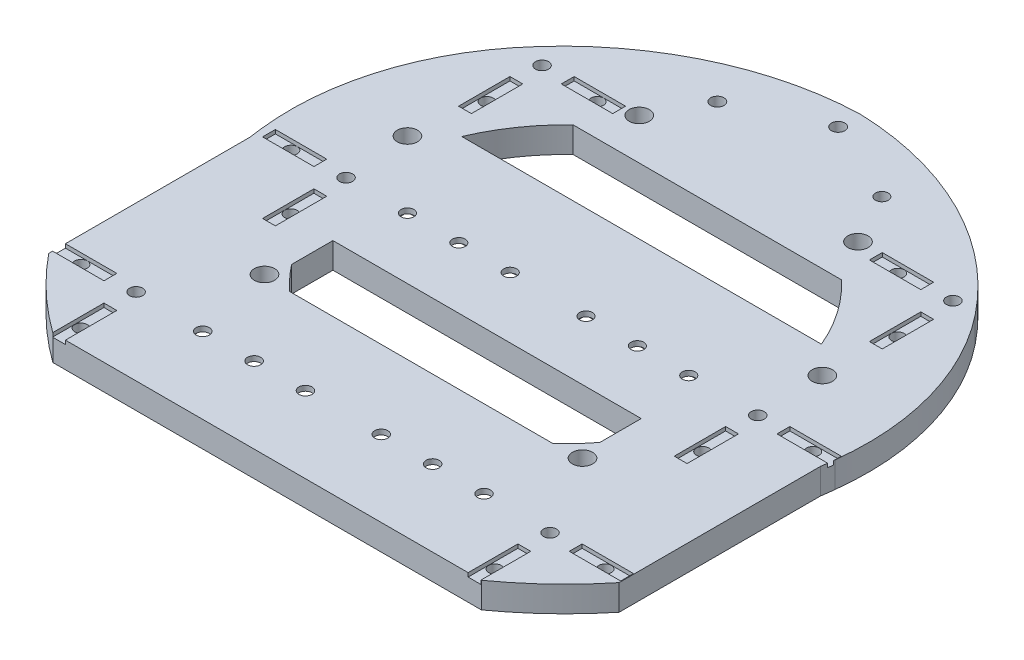
from build123d import *
from build123d.topology import SkipClean

# Parameters (mm, degrees)
SKETCH1_R            = 110
BOSS_EXTRUDE1_DEPTH  = 10
BOSS_EXTRUDE3_START  = -10
BOSS_EXTRUDE3_DEPTH  = 10
BOSS_EXTRUDE4_START  = -10
BOSS_EXTRUDE4_DEPTH  = 10
CUT_EXTRUDE5_START   = -10
CUT_EXTRUDE5_DEPTH   = 10
BOSS_EXTRUDE5_START  = -10
SKETCH13_W           = 9
SKETCH13_H           = 9.000138277
SKETCH13_R           = 2.45
BOSS_EXTRUDE5_DEPTH  = 10
SKETCH15_W           = 9
SKETCH15_H           = 0.2
BOSS_EXTRUDE6_DEPTH  = 10
SKETCH16_W           = 103.03
SKETCH16_H           = 6
CUT_EXTRUDE6_DEPTH   = 10
SKETCH18_W           = 9
SKETCH18_H           = 2
SKETCH18_W_2         = 103.03
BOSS_EXTRUDE7_DEPTH  = 10
CUT_EXTRUDE8_DEPTH   = 3
SKETCH22_W           = 35.363105004
SKETCH22_H           = 35.783804338
SKETCH22_W_2         = 37.314422683
BOSS_EXTRUDE8_DEPTH  = 10
SKETCH23_R           = 2.45
CUT_EXTRUDE9_DEPTH   = 10
SKETCH24_R           = 5
CUT_EXTRUDE10_DEPTH  = 5
SKETCH25_R           = 2.45
CUT_EXTRUDE11_DEPTH  = 10
SKETCH26_R           = 5
CUT_EXTRUDE12_DEPTH  = 5
SKETCH27_W           = 180
SKETCH27_H           = 5
BOSS_EXTRUDE9_DEPTH  = 20
SKETCH28_W           = 60.5
SKETCH28_H           = 20.5
CUT_EXTRUDE13_DEPTH  = 4
SKETCH29_R           = 2.45
CUT_EXTRUDE14_DEPTH  = 6
SKETCH30_W           = 60.5
SKETCH30_H           = 20
CUT_EXTRUDE15_DEPTH  = 3
SKETCH31_W           = 60.5
SKETCH31_H           = 20
CUT_EXTRUDE16_DEPTH  = 3
SKETCH32_R           = 2.45
CUT_EXTRUDE17_DEPTH  = 3
SKETCH33_R           = 2.45
CUT_EXTRUDE18_DEPTH  = 3
CUT_EXTRUDE19_DEPTH  = 13
SKETCH35_W           = 36
SKETCH35_H           = 35
CUT_EXTRUDE20_DEPTH  = 13
BOSS_EXTRUDE10_START = -10
BOSS_EXTRUDE10_DEPTH = 10
SKETCH37_W           = 5
SKETCH37_H           = 20
SKETCH37_W_2         = 20
SKETCH37_H_2         = 5
CUT_EXTRUDE21_DEPTH  = 1.5
SKETCH40_W           = 60.5
SKETCH40_H           = 20.5
CUT_EXTRUDE24_DEPTH  = 4
BOSS_EXTRUDE11_DEPTH = 10
CUT_EXTRUDE25_START  = -10
SKETCH42_R           = 148.189001984
SKETCH42_R_2         = 143
CUT_EXTRUDE25_DEPTH  = 10
SKETCH43_R           = 3.95
CUT_EXTRUDE26_DEPTH  = 10
SKETCH45_W           = 180
SKETCH45_H           = 20
SKETCH45_R           = 2.45
BOSS_EXTRUDE13_DEPTH = 0.5
SKETCH46_W           = 59.75
SKETCH46_H           = 20
CUT_EXTRUDE27_DEPTH  = 0.5
SKETCH47_W           = 60.5
SKETCH47_H           = 20
CUT_EXTRUDE28_DEPTH  = 0.5
SKETCH48_W           = 20
SKETCH48_H           = 5
CUT_EXTRUDE29_DEPTH  = 1.5
SKETCH50_R           = 2.45
CUT_EXTRUDE30_DEPTH  = 11.5
SKETCH49_R           = 2.45
CUT_EXTRUDE31_DEPTH  = 11.5
SKETCH51_R           = 2.45
CUT_EXTRUDE32_DEPTH  = 11.5
SKETCH52_R           = 5
CUT_EXTRUDE33_DEPTH  = 5
CUT_EXTRUDE34_DEPTH  = 3.5
SKETCH54_R           = 6.182205754
SKETCH54_R_2         = 6.908814994
SKETCH54_R_3         = 6.699083007
SKETCH54_R_4         = 7.311072075
BOSS_EXTRUDE14_DEPTH = 10
CUT_EXTRUDE35_START  = -10
CUT_EXTRUDE35_DEPTH  = 10
SKETCH56_R           = 2.45
CUT_EXTRUDE36_DEPTH  = 15
SKETCH57_R           = 2.45
CUT_EXTRUDE37_DEPTH  = 10
CUT_EXTRUDE38_DEPTH  = 4
SKETCH59_W           = 13.303250233
SKETCH59_H           = 41.760637686
SKETCH59_W_2         = 28.804428764
SKETCH59_H_2         = 13.418930669
SKETCH59_W_3         = 38.593692882
SKETCH59_H_3         = 11.205781994
SKETCH59_W_4         = 14.578154864
SKETCH59_H_4         = 26.454585746
SKETCH59_W_5         = 37.510014471
SKETCH59_H_5         = 13.104109406
SKETCH59_H_6         = 26.182090429
SKETCH59_W_6         = 39.272421329
SKETCH59_H_7         = 12.572135059
SKETCH59_W_7         = 13.81426775
SKETCH59_W_8         = 37.780808391
SKETCH59_H_8         = 10.64720748
SKETCH59_W_9         = 11.323538243
SKETCH59_H_9         = 26.005142941
SKETCH59_W_10        = 37.926829509
SKETCH59_H_10        = 11.922879481
SKETCH59_W_11        = 12.073705955
SKETCH59_H_11        = 25.690924596
BOSS_EXTRUDE15_DEPTH = 10
SKETCH62_W           = 60.5
SKETCH62_H           = 20.5
BOSS_EXTRUDE16_DEPTH = 4
SKETCH63_W           = 60.5
SKETCH63_H           = 20.5
SKETCH63_R           = 2.45
CUT_EXTRUDE40_DEPTH  = 4
SKETCH60_R           = 2.55
CUT_EXTRUDE41_DEPTH  = 14
SKETCH65_W           = 5
SKETCH65_H           = 20
SKETCH65_W_2         = 20
SKETCH65_H_2         = 5
CUT_EXTRUDE42_DEPTH  = 1.5
SKETCH66_R           = 2.45
CUT_EXTRUDE43_DEPTH  = 11.5
SKETCH67_W           = 180
SKETCH67_H           = 5
CUT_EXTRUDE44_DEPTH  = 20
BOSS_EXTRUDE17_DEPTH = 20.5
SKETCH70_W           = 180
SKETCH70_H           = 5
CUT_EXTRUDE45_DEPTH  = 20
BOSS_EXTRUDE18_DEPTH = 20.5
SKETCH72_R           = 2.475
CUT_EXTRUDE46_DEPTH  = 2
SKETCH73_R           = 2.475
CUT_EXTRUDE47_DEPTH  = 2
SKETCH74_R           = 6
BOSS_EXTRUDE19_DEPTH = 10
SKETCH75_R           = 2.6
SKETCH75_R_2         = 2.475
CUT_EXTRUDE48_DEPTH  = 10
CUT_EXTRUDE49_DEPTH  = 4
SKETCH77_R           = 5
CUT_EXTRUDE50_DEPTH  = 5
SKETCH79_R           = 2.5
CUT_EXTRUDE51_DEPTH  = 10
SKETCH80_W           = 60.5
SKETCH80_H           = 20.5
CUT_EXTRUDE52_DEPTH  = 4
SKETCH82_R           = 3.95
CUT_EXTRUDE53_DEPTH  = 10
SKETCH83_W           = 181.748773102
SKETCH83_H           = 4.533284398
SKETCH83_W_2         = 180.25
SKETCH83_H_2         = 5
CUT_EXTRUDE54_DEPTH  = 20.5
BOSS_EXTRUDE20_DEPTH = 10
CUT_EXTRUDE55_DEPTH  = 10
BOSS_EXTRUDE21_DEPTH = 10
CUT_EXTRUDE56_DEPTH  = 10
SKETCH89_W           = 35
SKETCH89_H           = 8.5
BOSS_EXTRUDE22_DEPTH = 10
BOSS_EXTRUDE23_DEPTH = 10
SKETCH91_W           = 80.389222886
SKETCH91_H           = 35
CUT_EXTRUDE57_DEPTH  = 10
BOSS_EXTRUDE24_DEPTH = 10
SKETCH95_W           = 140.000488143
SKETCH95_H           = 4.396142649
BOSS_EXTRUDE27_DEPTH = 10
SKETCH86_R           = 3.95
CUT_EXTRUDE58_DEPTH  = 10
SKETCH96_R           = 5
CUT_EXTRUDE59_DEPTH  = 4
SKETCH97_R           = 5
SKETCH97_R_2         = 2.55
CUT_EXTRUDE60_DEPTH  = 0.5
SKETCH98_W           = 0.250583084
SKETCH98_H           = 6.645186685
CUT_EXTRUDE61_DEPTH  = 10
SKETCH100_W          = 60.5
SKETCH100_H          = 20.5
BOSS_EXTRUDE28_DEPTH = 10
SKETCH101_R          = 2.55
CUT_EXTRUDE62_DEPTH  = 10
SKETCH102_W          = 61
SKETCH102_H          = 21
CUT_EXTRUDE63_DEPTH  = 8


with BuildPart() as part:
    # Sketch1 → Boss-Extrude1 (new body)
    with BuildSketch(Plane(origin=(0, 0, 0), x_dir=(1, 0, 0), z_dir=(0, 1, 0))):
        with Locations(Location((0, 0, 0), (0, 0, 270))):
            Circle(SKETCH1_R)
    extrude(amount=BOSS_EXTRUDE1_DEPTH)

    # Sketch10 → Boss-Extrude3 (add)
    with BuildSketch(Plane(origin=(0, 10, 0), x_dir=(1, 0, 0), z_dir=(0, 1, 0)).offset(BOSS_EXTRUDE3_START)):
        with BuildLine():
            Line((-50, 97.979589711), (-50, 125))
            Line((-50, 125), (50, 125))
            Line((50, 125), (50, 97.979589711))
            ThreePointArc((50, 97.979589711), (0, 110), (-50, 97.979589711))
        make_face()
    extrude(amount=BOSS_EXTRUDE3_DEPTH)

    # Sketch11 → Boss-Extrude4 (add)
    with BuildSketch(Plane(origin=(0, 10, 0), x_dir=(1, 0, 0), z_dir=(0, 1, 0)).offset(BOSS_EXTRUDE4_START)):
        with BuildLine():
            ThreePointArc((-56.77, 94.218719478), (-53.41810799, 96.158752793), (-50, 97.979589711))
            Line((-50, 97.979589711), (-50, 125))
            Line((-50, 125), (-56.77, 125))
            Line((-56.77, 125), (-56.77, 94.218719478))
        make_face()
    extrude(amount=BOSS_EXTRUDE4_DEPTH)

    # Sketch12 → Cut-Extrude5 (cut)
    with BuildSketch(Plane(origin=(0, 10, 0), x_dir=(1, 0, 0), z_dir=(0, 1, 0)).offset(CUT_EXTRUDE5_START)):
        with BuildLine():
            Line((50, 125), (46.26, 125))
            Line((46.26, 125), (46.26, 99.799861723))
            ThreePointArc((46.26, 99.799861723), (48.138604545, 98.907404942), (50, 97.979589711))
            Line((50, 97.979589711), (50, 125))
        make_face()
    extrude(amount=CUT_EXTRUDE5_DEPTH, mode=Mode.SUBTRACT)

    # Sketch13 → Boss-Extrude5 (add)
    # profile 1 of 4: a face of its own
    with BuildSketch(Plane(origin=(0, 10, 0), x_dir=(1, 0, 0), z_dir=(0, 1, 0)).offset(BOSS_EXTRUDE5_START)):
        with Locations((-61.27, 104.299930862)):
            Rectangle(SKETCH13_W, SKETCH13_H)
        with Locations(Location((-59.27, 104.299930862, 0), (0, 0, 270))):
            Circle(SKETCH13_R, mode=Mode.SUBTRACT)
    # profile 2 of 4: a face of its own
    with BuildSketch(Plane(origin=(0, 10, 0), x_dir=(1, 0, 0), z_dir=(0, 1, 0)).offset(BOSS_EXTRUDE5_START)):
        with BuildLine():
            Line((-65.77, 99.799861723), (-65.77, 88.17203128))
            ThreePointArc((-65.77, 88.17203128), (-61.344547513, 91.306333244), (-56.77, 94.218719478))
            Line((-56.77, 94.218719478), (-56.77, 99.799861723))
            Line((-56.77, 99.799861723), (-65.77, 99.799861723))
        make_face()
    # profile 3 of 4: a face of its own
    with BuildSketch(Plane(origin=(0, 10, 0), x_dir=(1, 0, 0), z_dir=(0, 1, 0)).offset(BOSS_EXTRUDE5_START)):
        with Locations((50.76, 104.299930862)):
            Rectangle(SKETCH13_W, SKETCH13_H)
        with Locations(Location((48.76, 104.299930862, 0), (0, 0, 270))):
            Circle(SKETCH13_R, mode=Mode.SUBTRACT)
    # profile 4 of 4: a face of its own
    with BuildSketch(Plane(origin=(0, 10, 0), x_dir=(1, 0, 0), z_dir=(0, 1, 0)).offset(BOSS_EXTRUDE5_START)):
        with BuildLine():
            Line((55.26, 95.112209521), (55.26, 99.799861723))
            Line((55.26, 99.799861723), (46.26, 99.799861723))
            ThreePointArc((46.26, 99.799861723), (50.814083882, 97.559873305), (55.26, 95.112209521))
        make_face()
    extrude(amount=BOSS_EXTRUDE5_DEPTH)

    # Sketch15 → Boss-Extrude6 (add)
    with BuildSketch(Plane(origin=(0, 10, 0), x_dir=(1, 0, 0), z_dir=(0, 1, 0))):
        with Locations((50.76, 108.9)):
            Rectangle(SKETCH15_W, SKETCH15_H)
        with Locations((-61.27, 108.9)):
            Rectangle(SKETCH15_W, SKETCH15_H)
    extrude(amount=-BOSS_EXTRUDE6_DEPTH)

    # Sketch16 → Cut-Extrude6 (cut)
    with BuildSketch(Plane(origin=(0, 10, 0), x_dir=(1, 0, 0), z_dir=(0, 1, 0))):
        with Locations((-5.255, 122)):
            Rectangle(SKETCH16_W, SKETCH16_H)
    extrude(amount=-CUT_EXTRUDE6_DEPTH, mode=Mode.SUBTRACT)

    # Sketch18 → Boss-Extrude7 (add)
    with BuildSketch(Plane(origin=(0, 10, 0), x_dir=(1, 0, 0), z_dir=(0, 1, 0))):
        with Locations((-61.27, 110)):
            Rectangle(SKETCH18_W, SKETCH18_H)
        with Locations((-5.255, 120)):
            Rectangle(SKETCH18_W_2, SKETCH18_H)
        with Locations((50.76, 110)):
            Rectangle(SKETCH18_W, SKETCH18_H)
    extrude(amount=-BOSS_EXTRUDE7_DEPTH)

    # Sketch19 → Cut-Extrude8 (cut)
    with BuildSketch(Plane.XZ):
        Polygon((-54.362522712, -104.299930862), (-56.816261356, -100.049930862), (-61.723738644, -100.049930862), (-64.177477288, -104.299930862), (-61.723738644, -108.549930862), (-56.816261356, -108.549930862), align=None)
        Polygon((53.667477288, -104.299930862), (51.213738644, -100.049930862), (46.306261356, -100.049930862), (43.852522712, -104.299930862), (46.306261356, -108.549930862), (51.213738644, -108.549930862), align=None)
        Polygon((-7.847522712, -114), (-10.301261356, -109.75), (-15.208738644, -109.75), (-17.662477288, -114), (-15.208738644, -118.25), (-10.301261356, -118.25), align=None)
        Polygon((7.152477288, -114), (4.698738644, -109.75), (-0.208738644, -109.75), (-2.662477288, -114), (-0.208738644, -118.25), (4.698738644, -118.25), align=None)
    extrude(amount=-CUT_EXTRUDE8_DEPTH, mode=Mode.SUBTRACT)

    # Sketch22 → Boss-Extrude8 (add)
    with BuildSketch(Plane(origin=(0, 10, 0), x_dir=(1, 0, 0), z_dir=(0, 1, 0))):
        with Locations((-72.318447498, -75.408097831)):
            Rectangle(SKETCH22_W, SKETCH22_H)
        with Locations((71.342788658, -75.408097831)):
            Rectangle(SKETCH22_W_2, SKETCH22_H)
    extrude(amount=-BOSS_EXTRUDE8_DEPTH)

    # Sketch23 → Cut-Extrude9 (cut)
    with BuildSketch(Plane.XZ):
        with Locations(Location((-80, 83.8, 0), (0, 0, 270))):
            Circle(SKETCH23_R)
        with Locations(Location((80, 83.8, 0), (0, 0, 270))):
            Circle(SKETCH23_R)
    extrude(amount=-CUT_EXTRUDE9_DEPTH, mode=Mode.SUBTRACT)

    # Sketch24 → Cut-Extrude10 (cut)
    with BuildSketch(Plane.XZ):
        with Locations(Location((-80, 83.8, 0), (0, 0, 270))):
            Circle(SKETCH24_R)
        with Locations(Location((80, 83.8, 0), (0, 0, 270))):
            Circle(SKETCH24_R)
    extrude(amount=-CUT_EXTRUDE10_DEPTH, mode=Mode.SUBTRACT)

    # Sketch25 → Cut-Extrude11 (cut)
    with BuildSketch(Plane.XZ):
        with Locations(Location((-80, 6.8, 0), (0, 0, 270))):
            Circle(SKETCH25_R)
        with Locations(Location((80, 6.8, 0), (0, 0, 90))):
            Circle(SKETCH25_R)
    extrude(amount=-CUT_EXTRUDE11_DEPTH, mode=Mode.SUBTRACT)

    # Sketch26 → Cut-Extrude12 (cut)
    with BuildSketch(Plane.XZ):
        with Locations(Location((-80, 6.8, 0), (0, 0, 270))):
            Circle(SKETCH26_R)
        with Locations(Location((80, 6.8, 0), (0, 0, 270))):
            Circle(SKETCH26_R)
    extrude(amount=-CUT_EXTRUDE12_DEPTH, mode=Mode.SUBTRACT)

    # Sketch27 → Boss-Extrude9 (add)
    with BuildSketch(Plane(origin=(0, 10, 0), x_dir=(1, 0, 0), z_dir=(0, 1, 0))):
        with Locations((0, -70.7)):
            Rectangle(SKETCH27_W, SKETCH27_H)
        with Locations((0, 5.8)):
            Rectangle(SKETCH27_W, SKETCH27_H)
    extrude(amount=BOSS_EXTRUDE9_DEPTH)

    # Sketch28 → Cut-Extrude13 (cut)
    with BuildSketch(Plane.XZ):
        with BuildLine():
            ThreePointArc((58.267572457, 93.3), (57.659545557, 93.676981197), (57.049079747, 94.05))
            Line((57.049079747, 94.05), (4.5, 94.05))
            Line((4.5, 94.05), (4.5, 73.55))
            Line((4.5, 73.55), (65, 73.55))
            Line((65, 73.55), (65, 93.3))
            Line((65, 93.3), (58.267572457, 93.3))
        make_face()
        with Locations((-34.75, 6.8)):
            Rectangle(SKETCH28_W, SKETCH28_H)
        with Locations((34.75, 6.8)):
            Rectangle(SKETCH28_W, SKETCH28_H)
        with Locations((-34.75, 83.8)):
            Rectangle(SKETCH28_W, SKETCH28_H)
    extrude(amount=-CUT_EXTRUDE13_DEPTH, mode=Mode.SUBTRACT)

    # Sketch29 → Cut-Extrude14 (cut)
    with BuildSketch(Plane.XZ.offset(-4)):
        with Locations(Location((-54.75, 86.3, 0), (0, 0, 270))):
            Circle(SKETCH29_R)
        with Locations(Location((-34.75, 86.3, 0), (0, 0, 270))):
            Circle(SKETCH29_R)
        with Locations(Location((-14.75, 86.3, 0), (0, 0, 270))):
            Circle(SKETCH29_R)
        with Locations(Location((14.75, 86.3, 0), (0, 0, 90))):
            Circle(SKETCH29_R)
        with Locations(Location((34.75, 86.3, 0), (0, 0, 90))):
            Circle(SKETCH29_R)
        with Locations(Location((54.75, 86.3, 0), (0, 0, 90))):
            Circle(SKETCH29_R)
        with Locations(Location((54.75, 6.8, 0), (0, 0, 270))):
            Circle(SKETCH29_R)
        with Locations(Location((34.75, 6.8, 0), (0, 0, 270))):
            Circle(SKETCH29_R)
        with Locations(Location((14.75, 6.8, 0), (0, 0, 270))):
            Circle(SKETCH29_R)
        with Locations(Location((-14.75, 6.8, 0), (0, 0, 90))):
            Circle(SKETCH29_R)
        with Locations(Location((-34.75, 6.8, 0), (0, 0, 90))):
            Circle(SKETCH29_R)
        with Locations(Location((-54.75, 6.8, 0), (0, 0, 90))):
            Circle(SKETCH29_R)
    extrude(amount=-CUT_EXTRUDE14_DEPTH, mode=Mode.SUBTRACT)

    # Sketch30 → Cut-Extrude15 (cut)
    with BuildSketch(Plane(origin=(0, 0, 68.2), x_dir=(-1, 0, 0), z_dir=(0, 0, -1))):
        with Locations((0, 20)):
            Rectangle(SKETCH30_W, SKETCH30_H)
    extrude(amount=-CUT_EXTRUDE15_DEPTH, mode=Mode.SUBTRACT)

    # Sketch31 → Cut-Extrude16 (cut)
    with BuildSketch(Plane(origin=(0, 0, -8.3), x_dir=(-1, 0, 0), z_dir=(0, 0, -1))):
        with Locations((0, 20)):
            Rectangle(SKETCH31_W, SKETCH31_H)
    extrude(amount=-CUT_EXTRUDE16_DEPTH, mode=Mode.SUBTRACT)

    # Sketch32 → Cut-Extrude17 (cut)
    with BuildSketch(Plane(origin=(0, 0, 71.2), x_dir=(-1, 0, 0), z_dir=(0, 0, -1))):
        with Locations((-20, 20)):
            Circle(SKETCH32_R)
        with Locations((0, 20)):
            Circle(SKETCH32_R)
        with Locations((20, 20)):
            Circle(SKETCH32_R)
    extrude(amount=-CUT_EXTRUDE17_DEPTH, mode=Mode.SUBTRACT)

    # Sketch33 → Cut-Extrude18 (cut)
    with BuildSketch(Plane(origin=(0, 0, -5.3), x_dir=(-1, 0, 0), z_dir=(0, 0, -1))):
        with Locations((20, 20)):
            Circle(SKETCH33_R)
        with Locations((0, 20)):
            Circle(SKETCH33_R)
        with Locations((-20, 20)):
            Circle(SKETCH33_R)
    extrude(amount=-CUT_EXTRUDE18_DEPTH, mode=Mode.SUBTRACT)

    # Sketch34 → Cut-Extrude19 (cut)
    with BuildSketch(Plane(origin=(0, 10, 0), x_dir=(1, 0, 0), z_dir=(0, 1, 0))):
        Polygon((-25, -22.05), (-60, -22.05), (-60, -52.05), (-60, -60.55), (-25, -60.55), align=None)
    extrude(amount=-CUT_EXTRUDE19_DEPTH, mode=Mode.SUBTRACT)

    # Sketch35 → Cut-Extrude20 (cut)
    with BuildSketch(Plane(origin=(0, 10, 0), x_dir=(1, 0, 0), z_dir=(0, 1, 0))):
        with Locations((-52, 42.7)):
            Rectangle(SKETCH35_W, SKETCH35_H)
    extrude(amount=-CUT_EXTRUDE20_DEPTH, mode=Mode.SUBTRACT)

    # Sketch36 → Boss-Extrude10 (add)
    with BuildSketch(Plane(origin=(0, 10, 0), x_dir=(1, 0, 0), z_dir=(0, 1, 0)).offset(BOSS_EXTRUDE10_START)):
        with BuildLine():
            Line((-110, -93.3), (-90, -93.3))
            Line((-90, -93.3), (-90, -73.2))
            Line((-90, -73.2), (-90, -63.245553203))
            ThreePointArc((-90, -63.245553203), (-104.880884817, -33.166247904), (-110, 0))
            Line((-110, 0), (-110, -93.3))
        make_face()
        with BuildLine():
            Line((-90, -113.3), (90, -113.3))
            Line((90, -113.3), (90, -93.3))
            Line((90, -93.3), (58.267572457, -93.3))
            ThreePointArc((58.267572457, -93.3), (0, -110), (-58.267572457, -93.3))
            Line((-58.267572457, -93.3), (-90, -93.3))
            Line((-90, -93.3), (-90, -113.3))
        make_face()
        with BuildLine():
            Line((90, -73.2), (90, -93.3))
            Line((90, -93.3), (110, -93.3))
            Line((110, -93.3), (110, 0))
            ThreePointArc((110, 0), (104.880884817, -33.166247904), (90, -63.245553203))
            Line((90, -63.245553203), (90, -73.2))
        make_face()
    extrude(amount=BOSS_EXTRUDE10_DEPTH)

    # Sketch37 → Cut-Extrude21 (cut)
    with BuildSketch(Plane(origin=(0, 10, 0), x_dir=(1, 0, 0), z_dir=(0, 1, 0))):
        with Locations((80.75, -26.8)):
            Rectangle(SKETCH37_W, SKETCH37_H)
        with Locations((100.75, -6.8)):
            Rectangle(SKETCH37_W_2, SKETCH37_H_2)
        with Locations((101.5, -83.8)):
            Rectangle(SKETCH37_W_2, SKETCH37_H_2)
        with Locations((81.25, 50.2)):
            Rectangle(SKETCH37_W, SKETCH37_H)
        with Locations((-81.75, 50.2)):
            Rectangle(SKETCH37_W, SKETCH37_H)
        with Locations((-101, -6.8)):
            Rectangle(SKETCH37_W_2, SKETCH37_H_2)
        with Locations((-81, -26.8)):
            Rectangle(SKETCH37_W, SKETCH37_H)
        with Locations((-101.5, -83.8)):
            Rectangle(SKETCH37_W_2, SKETCH37_H_2)
        with Locations((-81.5, -103.8)):
            Rectangle(SKETCH37_W, SKETCH37_H)
        with Locations((81.5, -103.8)):
            Rectangle(SKETCH37_W, SKETCH37_H)
        with Locations((101.25, 70.2)):
            Rectangle(SKETCH37_W_2, SKETCH37_H_2)
    extrude(amount=-CUT_EXTRUDE21_DEPTH, mode=Mode.SUBTRACT)

    # Sketch40 → Cut-Extrude24 (cut)
    with BuildSketch(Plane.XZ):
        with Locations((-34.75, 83.8)):
            Rectangle(SKETCH40_W, SKETCH40_H)
        with Locations((34.75, 83.8)):
            Rectangle(SKETCH40_W, SKETCH40_H)
    extrude(amount=-CUT_EXTRUDE24_DEPTH, mode=Mode.SUBTRACT)

    # Sketch41 → Boss-Extrude11 (add)
    with BuildSketch(Plane.XZ):
        with BuildLine():
            Line((-110, 0), (-110, 91.372862492))
            ThreePointArc((-110, 91.372862492), (-48.574684765, -134.497211867), (143, 0))
            ThreePointArc((143, 0), (134.497211867, 48.574684765), (110, 91.372862492))
            Line((110, 91.372862492), (110, 0))
            ThreePointArc((110, 0), (95.337820407, -54.869845999), (55.26, -95.112209521))
            Line((55.26, -95.112209521), (55.26, -111))
            Line((55.26, -111), (46.26, -111))
            Line((46.26, -111), (46.26, -121))
            Line((46.26, -121), (-56.77, -121))
            Line((-56.77, -121), (-56.77, -111))
            Line((-56.77, -111), (-65.77, -111))
            Line((-65.77, -111), (-65.77, -88.17203128))
            ThreePointArc((-65.77, -88.17203128), (-98.322683039, -49.321901829), (-110, 0))
        make_face()
        with BuildLine():
            Line((-108.370244994, 93.3), (-90, 93.3))
            Line((-90, 93.3), (-90, 111.126054551))
            ThreePointArc((-90, 111.126054551), (-99.584790907, 102.624896687), (-108.370244994, 93.3))
        make_face()
        with BuildLine():
            ThreePointArc((87.247406838, 113.3), (0, 143), (-87.247406838, 113.3))
            Line((-87.247406838, 113.3), (87.247406838, 113.3))
        make_face()
        with BuildLine():
            ThreePointArc((108.370244994, 93.3), (99.584790907, 102.624896687), (90, 111.126054551))
            Line((90, 111.126054551), (90, 93.3))
            Line((90, 93.3), (108.370244994, 93.3))
        make_face()
    extrude(amount=-BOSS_EXTRUDE11_DEPTH)

    # Sketch42 → Cut-Extrude25 (cut)
    with SkipClean():  # the faces are left unmerged after this step: merging them gives an invalid solid
        with BuildSketch(Plane(origin=(0, 10, 0), x_dir=(1, 0, 0), z_dir=(0, 1, 0)).offset(CUT_EXTRUDE25_START)):
            Circle(SKETCH42_R)
            with Locations(Location((0, 0, 0), (0, 0, 90))):
                Circle(SKETCH42_R_2, mode=Mode.SUBTRACT)
        extrude(amount=CUT_EXTRUDE25_DEPTH, mode=Mode.SUBTRACT)
    add(part.part.scale(1), mode=Mode.REPLACE)  # the faces are merged on a copy

    # Sketch43 → Cut-Extrude26 (cut)
    with BuildSketch(Plane(origin=(0, 10, 0), x_dir=(1, 0, 0), z_dir=(0, 1, 0))):
        with Locations(Location((0, 133.5, 0), (0, 0, 270))):
            Circle(SKETCH43_R)
        with Locations(Location((115.614391405, 66.75, 0), (0, 0, 270))):
            Circle(SKETCH43_R)
        with Locations(Location((115.614391405, -66.75, 0), (0, 0, 270))):
            Circle(SKETCH43_R)
        with Locations(Location((0, -133.5, 0), (0, 0, 270))):
            Circle(SKETCH43_R)
        with Locations(Location((-115.614391405, -66.75, 0), (0, 0, 270))):
            Circle(SKETCH43_R)
        with Locations(Location((-115.614391405, 66.75, 0), (0, 0, 270))):
            Circle(SKETCH43_R)
    extrude(amount=-CUT_EXTRUDE26_DEPTH, mode=Mode.SUBTRACT)

    # Sketch45 → Boss-Extrude13 (add)
    with BuildSketch(Plane.XY.offset(73.2)):
        with Locations((0, 20)):
            Rectangle(SKETCH45_W, SKETCH45_H)
        with Locations(Location((-20, 20, 0), (0, 0, 180))):
            Circle(SKETCH45_R, mode=Mode.SUBTRACT)
        with Locations(Location((0, 20, 0), (0, 0, 180))):
            Circle(SKETCH45_R, mode=Mode.SUBTRACT)
        with Locations(Location((20, 20, 0), (0, 0, 180))):
            Circle(SKETCH45_R, mode=Mode.SUBTRACT)
    extrude(amount=BOSS_EXTRUDE13_DEPTH)

    # Sketch46 → Cut-Extrude27 (cut)
    with BuildSketch(Plane(origin=(0, 0, 68.2), x_dir=(-1, 0, 0), z_dir=(0, 0, -1))):
        with Locations((-60.125, 20)):
            Rectangle(SKETCH46_W, SKETCH46_H)
        with Locations((60.125, 20)):
            Rectangle(SKETCH46_W, SKETCH46_H)
    extrude(amount=-CUT_EXTRUDE27_DEPTH, mode=Mode.SUBTRACT)

    # Sketch47 → Cut-Extrude28 (cut)
    with BuildSketch(Plane(origin=(0, 0, 71.2), x_dir=(-1, 0, 0), z_dir=(0, 0, -1))):
        with Locations((0, 20)):
            Rectangle(SKETCH47_W, SKETCH47_H)
    extrude(amount=-CUT_EXTRUDE28_DEPTH, mode=Mode.SUBTRACT)

    # Sketch48 → Cut-Extrude29 (cut)
    with BuildSketch(Plane(origin=(0, 10, 0), x_dir=(1, 0, 0), z_dir=(0, 1, 0))):
        with Locations((-61.75, 70.2)):
            Rectangle(SKETCH48_W, SKETCH48_H)
        with Locations((61.25, 70.2)):
            Rectangle(SKETCH48_W, SKETCH48_H)
    extrude(amount=-CUT_EXTRUDE29_DEPTH, mode=Mode.SUBTRACT)

    # Sketch50 → Cut-Extrude30 (cut)
    with BuildSketch(Plane(origin=(0, 8.5, 0), x_dir=(1, 0, 0), z_dir=(0, 1, 0))):
        with Locations(Location((-80, -28.25, 0), (0, 0, 270))):
            Circle(SKETCH50_R)
        with Locations(Location((80, -28.25, 0), (0, 0, 270))):
            Circle(SKETCH50_R)
        with Locations(Location((102.2, -6.8, 0), (0, 0, 270))):
            Circle(SKETCH50_R)
        with Locations(Location((102.95, -83.8, 0), (0, 0, 270))):
            Circle(SKETCH50_R)
        with Locations(Location((80, -105.25, 0), (0, 0, 270))):
            Circle(SKETCH50_R)
        with Locations(Location((-80, -105.25, 0), (0, 0, 270))):
            Circle(SKETCH50_R)
        with Locations(Location((-102.95, -83.8, 0), (0, 0, 270))):
            Circle(SKETCH50_R)
        with Locations(Location((80, 48.75, 0), (0, 0, 270))):
            Circle(SKETCH50_R)
        with Locations(Location((59.8, 70.2, 0), (0, 0, 270))):
            Circle(SKETCH50_R)
        with Locations(Location((-60.3, 70.2, 0), (0, 0, 270))):
            Circle(SKETCH50_R)
        with Locations(Location((-80, 48.75, 0), (0, 0, 270))):
            Circle(SKETCH50_R)
    extrude(amount=-CUT_EXTRUDE30_DEPTH, mode=Mode.SUBTRACT)

    # Sketch49 → Cut-Extrude31 (cut)
    with BuildSketch(Plane(origin=(0, 8.5, 0), x_dir=(1, 0, 0), z_dir=(0, 1, 0))):
        with Locations(Location((-102.45, -6.8, 0), (0, 0, 270))):
            Circle(SKETCH49_R)
    extrude(amount=-CUT_EXTRUDE31_DEPTH, mode=Mode.SUBTRACT)

    # Sketch51 → Cut-Extrude32 (cut)
    with BuildSketch(Plane(origin=(0, 10, 0), x_dir=(1, 0, 0), z_dir=(0, 1, 0))):
        with Locations(Location((-81.75, 70.2, 0), (0, 0, 270))):
            Circle(SKETCH51_R)
        with Locations(Location((81.25, 70.2, 0), (0, 0, 270))):
            Circle(SKETCH51_R)
    extrude(amount=-CUT_EXTRUDE32_DEPTH, mode=Mode.SUBTRACT)

    # Sketch52 → Cut-Extrude33 (cut)
    with BuildSketch(Plane.XZ):
        with Locations(Location((-81.75, -70.2, 0), (0, 0, 270))):
            Circle(SKETCH52_R)
        with Locations(Location((81.25, -70.2, 0), (0, 0, 270))):
            Circle(SKETCH52_R)
    extrude(amount=-CUT_EXTRUDE33_DEPTH, mode=Mode.SUBTRACT)

    # Sketch53 → Cut-Extrude34 (cut)
    with BuildSketch(Plane.XZ):
        Polygon((84.907477288, 28.25), (82.453738644, 32.5), (77.546261356, 32.5), (75.092522712, 28.25), (77.546261356, 24), (82.453738644, 24), align=None)
        Polygon((107.107477288, 6.8), (104.653738644, 11.05), (99.746261356, 11.05), (97.292522712, 6.8), (99.746261356, 2.55), (104.653738644, 2.55), align=None)
        Polygon((84.907477288, -48.75), (82.453738644, -44.5), (77.546261356, -44.5), (75.092522712, -48.75), (77.546261356, -53), (82.453738644, -53), align=None)
        Polygon((64.707477288, -70.2), (62.253738644, -65.95), (57.346261356, -65.95), (54.892522712, -70.2), (57.346261356, -74.45), (62.253738644, -74.45), align=None)
        Polygon((-75.092522712, -48.75), (-77.546261356, -44.5), (-82.453738644, -44.5), (-84.907477288, -48.75), (-82.453738644, -53), (-77.546261356, -53), align=None)
        Polygon((-55.392522712, -70.2), (-57.846261356, -65.95), (-62.753738644, -65.95), (-65.207477288, -70.2), (-62.753738644, -74.45), (-57.846261356, -74.45), align=None)
        Polygon((-75.092522712, 28.25), (-77.546261356, 32.5), (-82.453738644, 32.5), (-84.907477288, 28.25), (-82.453738644, 24), (-77.546261356, 24), align=None)
        Polygon((-97.542522712, 6.8), (-99.996261356, 11.05), (-104.903738644, 11.05), (-107.357477288, 6.8), (-104.903738644, 2.55), (-99.996261356, 2.55), align=None)
    extrude(amount=-CUT_EXTRUDE34_DEPTH, mode=Mode.SUBTRACT)

    # Sketch54 → Boss-Extrude14 (add)
    with BuildSketch(Plane.XZ):
        with Locations((-59.27, -104.299930862)):
            Circle(SKETCH54_R)
        with Locations((-12.755, -114)):
            Circle(SKETCH54_R_2)
        with Locations((2.245, -114)):
            Circle(SKETCH54_R_3)
        with Locations((48.76, -104.299930862)):
            Circle(SKETCH54_R_4)
    extrude(amount=-BOSS_EXTRUDE14_DEPTH)

    # Sketch55 → Cut-Extrude35 (cut)
    with BuildSketch(Plane(origin=(0, 10, 0), x_dir=(1, 0, 0), z_dir=(0, 1, 0)).offset(CUT_EXTRUDE35_START)):
        with BuildLine():
            Line((-125, 69.455021417), (-125, -69.455021417))
            ThreePointArc((-125, -69.455021417), (-143, 0), (-125, 69.455021417))
        make_face()
        with BuildLine():
            Line((125, 69.455021417), (125, -69.455021417))
            ThreePointArc((125, -69.455021417), (143, 0), (125, 69.455021417))
        make_face()
    extrude(amount=CUT_EXTRUDE35_DEPTH, mode=Mode.SUBTRACT)

    # Sketch56 → Cut-Extrude36 (cut)
    with BuildSketch(Plane(origin=(0, 10, 0), x_dir=(1, 0, 0), z_dir=(0, 1, 0))):
        with Locations(Location((-33.765, 89, 0), (0, 0, 270))):
            Circle(SKETCH56_R)
        with Locations(Location((33.265, 89, 0), (0, 0, 270))):
            Circle(SKETCH56_R)
    extrude(amount=-CUT_EXTRUDE36_DEPTH, mode=Mode.SUBTRACT)

    # Sketch57 → Cut-Extrude37 (cut)
    with BuildSketch(Plane(origin=(0, 10, 0), x_dir=(1, 0, 0), z_dir=(0, 1, 0))):
        with Locations(Location((-0.25, 104, 0), (0, 0, 270))):
            Circle(SKETCH57_R)
    extrude(amount=-CUT_EXTRUDE37_DEPTH, mode=Mode.SUBTRACT)

    # Sketch58 → Cut-Extrude38 (cut)
    with BuildSketch(Plane.XZ):
        Polygon((-28.857522712, -89), (-31.311261356, -84.75), (-36.218738644, -84.75), (-38.672477288, -89), (-36.218738644, -93.25), (-31.311261356, -93.25), align=None)
        Polygon((4.657477288, -104), (2.203738644, -99.75), (-2.703738644, -99.75), (-5.157477288, -104), (-2.703738644, -108.25), (2.203738644, -108.25), align=None)
        Polygon((38.172477288, -89), (35.718738644, -84.75), (30.811261356, -84.75), (28.357522712, -89), (30.811261356, -93.25), (35.718738644, -93.25), align=None)
    extrude(amount=-CUT_EXTRUDE38_DEPTH, mode=Mode.SUBTRACT)

    # Sketch59 → Boss-Extrude15 (add)
    with BuildSketch(Plane(origin=(0, 10, 0), x_dir=(1, 0, 0), z_dir=(0, 1, 0))):
        with Locations((-80.801871233, 56.844410402)):
            Rectangle(SKETCH59_W, SKETCH59_H)
        with Locations((-59.748031734, 71.015263911)):
            Rectangle(SKETCH59_W_2, SKETCH59_H_2)
        with Locations((68.872472692, 69.908689573)):
            Rectangle(SKETCH59_W_3, SKETCH59_H_3)
        with Locations((80.880241701, 51.078505703)):
            Rectangle(SKETCH59_W_4, SKETCH59_H_4)
        with Locations((-92.905253352, -6.069207479)):
            Rectangle(SKETCH59_W_5, SKETCH59_H_5)
        with Locations((-80.801871233, -25.712307397)):
            Rectangle(SKETCH59_W, SKETCH59_H_6)
        with Locations((91.858562137, -6.335194653)):
            Rectangle(SKETCH59_W_6, SKETCH59_H_7)
        with Locations((79.129485347, -25.712307397)):
            Rectangle(SKETCH59_W_7, SKETCH59_H_6)
        with Locations((-92.769856392, -82.288739236)):
            Rectangle(SKETCH59_W_8, SKETCH59_H_8)
        with Locations((-79.541221318, -100.614914447)):
            Rectangle(SKETCH59_W_9, SKETCH59_H_9)
        with Locations((91.851843113, -82.763447439)):
            Rectangle(SKETCH59_W_10, SKETCH59_H_10)
        with Locations((78.925281336, -101.570349478)):
            Rectangle(SKETCH59_W_11, SKETCH59_H_11)
    extrude(amount=-BOSS_EXTRUDE15_DEPTH)

    # Sketch62 → Boss-Extrude16 (add)
    with BuildSketch(Plane.XZ):
        with Locations((-34.75, 83.8)):
            Rectangle(SKETCH62_W, SKETCH62_H)
        with Locations((34.75, 83.8)):
            Rectangle(SKETCH62_W, SKETCH62_H)
    extrude(amount=-BOSS_EXTRUDE16_DEPTH)

    # Sketch63 → Cut-Extrude40 (cut)
    # profile 1 of 2: a face of its own
    with BuildSketch(Plane.XZ):
        with Locations((-34.75, 86.3)):
            Rectangle(SKETCH63_W, SKETCH63_H)
        with Locations(Location((-14.75, 86.3, 0), (0, 0, 270))):
            Circle(SKETCH63_R, mode=Mode.SUBTRACT)
        with Locations(Location((-34.75, 86.3, 0), (0, 0, 270))):
            Circle(SKETCH63_R, mode=Mode.SUBTRACT)
        with Locations(Location((-54.75, 86.3, 0), (0, 0, 270))):
            Circle(SKETCH63_R, mode=Mode.SUBTRACT)
    # profile 2 of 2: a face of its own
    with BuildSketch(Plane.XZ):
        with Locations((34.75, 86.3)):
            Rectangle(SKETCH63_W, SKETCH63_H)
        with Locations(Location((14.75, 86.3, 0), (0, 0, 270))):
            Circle(SKETCH63_R, mode=Mode.SUBTRACT)
        with Locations(Location((34.75, 86.3, 0), (0, 0, 270))):
            Circle(SKETCH63_R, mode=Mode.SUBTRACT)
        with Locations(Location((54.75, 86.3, 0), (0, 0, 270))):
            Circle(SKETCH63_R, mode=Mode.SUBTRACT)
    extrude(amount=-CUT_EXTRUDE40_DEPTH, mode=Mode.SUBTRACT)


with BuildPart() as cut_extrude40_kept_piece:
    # of the separate pieces the step leaves, the one the design keeps (cut_extrude40_pieces_kept)
    add(part.part.solids().sort_by_distance((125, 0, 69.455021417))[0])

    # Sketch60 → Cut-Extrude41 (cut)
    with BuildSketch(Plane(origin=(0, 10, 0), x_dir=(1, 0, 0), z_dir=(0, 1, 0))):
        with Locations(Location((80.749095009, -86.8, 0), (0, 0, 270))):
            Circle(SKETCH60_R)
        with Locations(Location((-80.999678093, -86.17, 0), (0, 0, 270))):
            Circle(SKETCH60_R)
        with Locations(Location((-78.649678093, -6.8, 0), (0, 0, 270))):
            Circle(SKETCH60_R)
        with Locations(Location((-78.349696153, 69.199407964, 0), (0, 0, 270))):
            Circle(SKETCH60_R)
        with Locations(Location((80.949095009, 69.82, 0), (0, 0, 270))):
            Circle(SKETCH60_R)
        with Locations(Location((81.600321907, -6.8, 0), (0, 0, 270))):
            Circle(SKETCH60_R)
    extrude(amount=-CUT_EXTRUDE41_DEPTH, mode=Mode.SUBTRACT)

    # Sketch65 → Cut-Extrude42 (cut)
    with BuildSketch(Plane(origin=(0, 10, 0), x_dir=(1, 0, 0), z_dir=(0, 1, 0))):
        with Locations((81.600321907, -26.8)):
            Rectangle(SKETCH65_W, SKETCH65_H)
        with Locations((-78.349696153, 49.199407964)):
            Rectangle(SKETCH65_W, SKETCH65_H)
        with Locations((-58.349696153, 69.199407964)):
            Rectangle(SKETCH65_W_2, SKETCH65_H_2)
        with Locations((60.949095009, 69.82)):
            Rectangle(SKETCH65_W_2, SKETCH65_H_2)
        with Locations((80.949095009, 49.82)):
            Rectangle(SKETCH65_W, SKETCH65_H)
        with Locations((101.600321907, -6.8)):
            Rectangle(SKETCH65_W_2, SKETCH65_H_2)
        with Locations((-78.649678093, -26.8)):
            Rectangle(SKETCH65_W, SKETCH65_H)
        with Locations((-98.649678093, -6.8)):
            Rectangle(SKETCH65_W_2, SKETCH65_H_2)
        with Locations((-100.999678093, -86.17)):
            Rectangle(SKETCH65_W_2, SKETCH65_H_2)
        with Locations((-80.999678093, -106.17)):
            Rectangle(SKETCH65_W, SKETCH65_H)
        with Locations((80.749095009, -106.8)):
            Rectangle(SKETCH65_W, SKETCH65_H)
        with Locations((100.749095009, -86.8)):
            Rectangle(SKETCH65_W_2, SKETCH65_H_2)
    extrude(amount=-CUT_EXTRUDE42_DEPTH, mode=Mode.SUBTRACT)

    # Sketch66 → Cut-Extrude43 (cut)
    with BuildSketch(Plane(origin=(0, 8.5, 0), x_dir=(1, 0, 0), z_dir=(0, 1, 0))):
        with Locations(Location((-56.899696153, 69.199407964, 0), (0, 0, 270))):
            Circle(SKETCH66_R)
        with Locations(Location((-78.349696153, 47.749407964, 0), (0, 0, 270))):
            Circle(SKETCH66_R)
        with Locations(Location((59.499095009, 69.82, 0), (0, 0, 270))):
            Circle(SKETCH66_R)
        with Locations(Location((80.949095009, 48.37, 0), (0, 0, 270))):
            Circle(SKETCH66_R)
        with Locations(Location((103.050321907, -6.8, 0), (0, 0, 270))):
            Circle(SKETCH66_R)
        with Locations(Location((81.600321907, -28.25, 0), (0, 0, 270))):
            Circle(SKETCH66_R)
        with Locations(Location((-100.099678093, -6.8, 0), (0, 0, 270))):
            Circle(SKETCH66_R)
        with Locations(Location((-78.649678093, -28.25, 0), (0, 0, 270))):
            Circle(SKETCH66_R)
        with Locations(Location((-102.449678093, -86.17, 0), (0, 0, 270))):
            Circle(SKETCH66_R)
        with Locations(Location((-80.999678093, -107.62, 0), (0, 0, 270))):
            Circle(SKETCH66_R)
        with Locations(Location((102.199095009, -86.8, 0), (0, 0, 270))):
            Circle(SKETCH66_R)
        with Locations(Location((80.749095009, -108.25, 0), (0, 0, 270))):
            Circle(SKETCH66_R)
    extrude(amount=-CUT_EXTRUDE43_DEPTH, mode=Mode.SUBTRACT)

    # Sketch67 → Cut-Extrude44 (cut)
    with BuildSketch(Plane(origin=(0, 30, 0), x_dir=(1, 0, 0), z_dir=(0, 1, 0))):
        with Locations((0, -71.2)):
            Rectangle(SKETCH67_W, SKETCH67_H)
    extrude(amount=-CUT_EXTRUDE44_DEPTH, mode=Mode.SUBTRACT)

    # Sketch68 → Boss-Extrude17 (add)
    with BuildSketch(Plane(origin=(0, 10, 0), x_dir=(1, 0, 0), z_dir=(0, 1, 0))):
        Polygon((-90.999678093, -75.3), (-90.999678093, -70.766715602), (-30.375291542, -70.766715602), (-30.375291542, -73.500159137), (30.124708458, -73.500159137), (30.124708458, -70.766715602), (90.749095009, -70.766715602), (90.749095009, -75.3), align=None)
    extrude(amount=BOSS_EXTRUDE17_DEPTH)

    # Sketch70 → Cut-Extrude45 (cut)
    with BuildSketch(Plane(origin=(0, 30, 0), x_dir=(1, 0, 0), z_dir=(0, 1, 0))):
        with Locations((0, 5.8)):
            Rectangle(SKETCH70_W, SKETCH70_H)
    extrude(amount=-CUT_EXTRUDE45_DEPTH, mode=Mode.SUBTRACT)

    # Sketch71 → Boss-Extrude18 (add)
    with BuildSketch(Plane(origin=(0, 10, 0), x_dir=(1, 0, 0), z_dir=(0, 1, 0))):
        Polygon((-88.649678093, 9.2), (-88.649678093, 4.2), (91.600321907, 4.2), (91.600321907, 9.2), (30.25, 9.2), (30.25, 6.2), (-30.25, 6.2), (-30.25, 9.2), align=None)
    extrude(amount=BOSS_EXTRUDE18_DEPTH)

    # Sketch72 → Cut-Extrude46 (cut)
    with BuildSketch(Plane(origin=(0, 0, 73.500159137), x_dir=(-1, 0, 0), z_dir=(0, 0, -1))):
        with Locations((-19.874708458, 20.25)):
            Circle(SKETCH72_R)
        with Locations((0.125291542, 20.25)):
            Circle(SKETCH72_R)
        with Locations((20.125291542, 20.25)):
            Circle(SKETCH72_R)
    extrude(amount=-CUT_EXTRUDE46_DEPTH, mode=Mode.SUBTRACT)

    # Sketch73 → Cut-Extrude47 (cut)
    with BuildSketch(Plane(origin=(0, 0, -6.2), x_dir=(-1, 0, 0), z_dir=(0, 0, -1))):
        with Locations((-20, 20.25)):
            Circle(SKETCH73_R)
        with Locations((0, 20.25)):
            Circle(SKETCH73_R)
        with Locations((20, 20.25)):
            Circle(SKETCH73_R)
    extrude(amount=-CUT_EXTRUDE47_DEPTH, mode=Mode.SUBTRACT)

    # Sketch74 → Boss-Extrude19 (add)
    with BuildSketch(Plane(origin=(0, 10, 0), x_dir=(1, 0, 0), z_dir=(0, 1, 0))):
        with Locations((-0.25, 104)):
            Circle(SKETCH74_R)
        with Locations((33.265, 89)):
            Circle(SKETCH74_R)
        with Locations((-33.765, 89)):
            Circle(SKETCH74_R)
    extrude(amount=-BOSS_EXTRUDE19_DEPTH)

    # Sketch75 → Cut-Extrude48 (cut)
    with BuildSketch(Plane(origin=(0, 10, 0), x_dir=(1, 0, 0), z_dir=(0, 1, 0))):
        with Locations(Location((0, 106.09502142, 0), (0, 0, 270))):
            Circle(SKETCH75_R)
        with Locations(Location((-32.02, 91.09502142, 0), (0, 0, 270))):
            Circle(SKETCH75_R)
        with Locations(Location((32.02, 91.09502142, 0), (0, 0, 270))):
            Circle(SKETCH75_R_2)
    extrude(amount=-CUT_EXTRUDE48_DEPTH, mode=Mode.SUBTRACT)

    # Sketch76 → Cut-Extrude49 (cut)
    with BuildSketch(Plane.XZ):
        Polygon((-73.742200805, 28.25), (-76.195939449, 32.5), (-81.103416737, 32.5), (-83.557155381, 28.25), (-81.103416737, 24), (-76.195939449, 24), align=None)
        Polygon((-95.192200805, 6.8), (-97.645939449, 11.05), (-102.553416737, 11.05), (-105.007155381, 6.8), (-102.553416737, 2.55), (-97.645939449, 2.55), align=None)
        Polygon((86.507799195, 28.25), (84.054060551, 32.5), (79.146583263, 32.5), (76.692844619, 28.25), (79.146583263, 24), (84.054060551, 24), align=None)
        Polygon((107.957799195, 6.8), (105.504060551, 11.05), (100.596583263, 11.05), (98.142844619, 6.8), (100.596583263, 2.55), (105.504060551, 2.55), align=None)
        Polygon((85.842223763, -48.744999107), (83.720418139, -44.319925749), (78.827289385, -43.944926642), (76.055966255, -47.995000893), (78.177771879, -52.420074251), (83.070900633, -52.795073358), align=None)
        Polygon((64.392223763, -70.194999107), (62.270418139, -65.769925749), (57.377289385, -65.394926642), (54.605966255, -69.445000893), (56.727771879, -73.870074251), (61.620900633, -74.245073358), align=None)
        Polygon((-73.736598666, -49.423524122), (-74.593320288, -44.591406429), (-79.206417774, -42.917290271), (-82.96279364, -46.075291806), (-82.106072018, -50.907409498), (-77.492974531, -52.581525656), align=None)
        Polygon((-52.286598666, -70.873524122), (-53.143320288, -66.041406429), (-57.756417774, -64.367290271), (-61.51279364, -67.525291806), (-60.656072018, -72.357409498), (-56.042974531, -74.031525656), align=None)
        Polygon((-27.508250621, -89.164360685), (-31.436126554, -86.222401475), (-35.947875932, -88.15306221), (-36.531749379, -93.025682155), (-32.603873446, -95.967641365), (-28.092124068, -94.03698063), align=None)
        Polygon((4.511749379, -104.164360685), (0.583873446, -101.222401475), (-3.927875932, -103.15306221), (-4.511749379, -108.025682155), (-0.583873446, -110.967641365), (3.927875932, -109.03698063), align=None)
        Polygon((36.531749379, -89.164360685), (32.603873446, -86.222401475), (28.092124068, -88.15306221), (27.508250621, -93.025682155), (31.436126554, -95.967641365), (35.947875932, -94.03698063), align=None)
    extrude(amount=-CUT_EXTRUDE49_DEPTH, mode=Mode.SUBTRACT)

    # Sketch77 → Cut-Extrude50 (cut)
    with BuildSketch(Plane.XZ):
        with Locations(Location((-78.649678093, 6.8, 0), (0, 0, 270))):
            Circle(SKETCH77_R)
        with Locations(Location((81.600321907, 6.8, 0), (0, 0, 270))):
            Circle(SKETCH77_R)
        with Locations(Location((80.949095009, -69.82, 0), (0, 0, 270))):
            Circle(SKETCH77_R)
        with Locations(Location((-78.349696153, -69.199407964, 0), (0, 0, 270))):
            Circle(SKETCH77_R)
    extrude(amount=-CUT_EXTRUDE50_DEPTH, mode=Mode.SUBTRACT)

    # Sketch79 → Cut-Extrude51 (cut)
    with BuildSketch(Plane.XZ.offset(-4)):
        with Locations(Location((-54.75, 86.3, 0), (0, 0, 270))):
            Circle(SKETCH79_R)
        with Locations(Location((-34.75, 86.3, 0), (0, 0, 270))):
            Circle(SKETCH79_R)
        with Locations(Location((-14.75, 86.3, 0), (0, 0, 270))):
            Circle(SKETCH79_R)
        with Locations(Location((14.75, 86.3, 0), (0, 0, 270))):
            Circle(SKETCH79_R)
        with Locations(Location((34.75, 86.3, 0), (0, 0, 270))):
            Circle(SKETCH79_R)
        with Locations(Location((54.75, 86.3, 0), (0, 0, 270))):
            Circle(SKETCH79_R)
        with Locations(Location((-54.75, 6.8, 0), (0, 0, 270))):
            Circle(SKETCH79_R)
        with Locations(Location((-34.75, 6.8, 0), (0, 0, 270))):
            Circle(SKETCH79_R)
        with Locations(Location((-14.75, 6.8, 0), (0, 0, 270))):
            Circle(SKETCH79_R)
        with Locations(Location((14.75, 6.8, 0), (0, 0, 270))):
            Circle(SKETCH79_R)
        with Locations(Location((34.75, 6.8, 0), (0, 0, 270))):
            Circle(SKETCH79_R)
        with Locations(Location((54.75, 6.8, 0), (0, 0, 270))):
            Circle(SKETCH79_R)
    extrude(amount=-CUT_EXTRUDE51_DEPTH, mode=Mode.SUBTRACT)

    # Sketch80 → Cut-Extrude52 (cut)
    with BuildSketch(Plane.XZ.offset(-4)):
        with Locations((-34.75, 86.3)):
            Rectangle(SKETCH80_W, SKETCH80_H)
        with Locations((34.75, 86.3)):
            Rectangle(SKETCH80_W, SKETCH80_H)
        with Locations((-34.75, 6.8)):
            Rectangle(SKETCH80_W, SKETCH80_H)
        with Locations((34.75, 6.8)):
            Rectangle(SKETCH80_W, SKETCH80_H)
    extrude(amount=-CUT_EXTRUDE52_DEPTH, mode=Mode.SUBTRACT)

    # Sketch82 → Cut-Extrude53 (cut)
    # profile 1 of 4: a face of its own
    with BuildSketch(Plane(origin=(0, 10, 0), x_dir=(1, 0, 0), z_dir=(0, 1, 0))):
        with BuildLine():
            ThreePointArc((125, 69.455021417), (0, 143), (-125, 69.455021417))
            Line((-125, 69.455021417), (-118.492821383, 69.455021417))
            ThreePointArc((-118.492821383, 69.455021417), (-115.614391405, 70.7), (-112.735961428, 69.455021417))
            Line((-112.735961428, 69.455021417), (-90, 69.455021417))
            ThreePointArc((-90, 69.455021417), (-49.976710526, 101.975639175), (0, 114.69502142))
            ThreePointArc((0, 114.69502142), (49.976710526, 101.975639175), (90, 69.455021417))
            Line((90, 69.455021417), (112.735961428, 69.455021417))
            ThreePointArc((112.735961428, 69.455021417), (115.614391405, 70.7), (118.492821383, 69.455021417))
            Line((118.492821383, 69.455021417), (125, 69.455021417))
        make_face()
        with Locations((0, 133.5)):
            Circle(SKETCH82_R, mode=Mode.SUBTRACT)
    # profile 2 of 4: a face of its own
    with BuildSketch(Plane(origin=(0, 10, 0), x_dir=(1, 0, 0), z_dir=(0, 1, 0))):
        with BuildLine():
            ThreePointArc((-118.710199034, -79.730098741), (-121.963353438, -74.658826793), (-125, -69.455021417))
            Line((-125, -69.455021417), (-125, 69.455021417))
            Line((-125, 69.455021417), (-90, 69.455021417))
            ThreePointArc((-90, 69.455021417), (-108.459612319, 33.495110698), (-111.649678093, -6.8))
            ThreePointArc((-111.649678093, -6.8), (-104.198559278, -44.078782623), (-90.999678093, -79.730098741))
            Line((-90.999678093, -79.730098741), (-118.710199034, -79.730098741))
        make_face()
    # profile 3 of 4: a face of its own
    with BuildSketch(Plane(origin=(0, 10, 0), x_dir=(1, 0, 0), z_dir=(0, 1, 0))):
        with BuildLine():
            Line((125, 69.455021417), (90, 69.455021417))
            ThreePointArc((90, 69.455021417), (108.459612319, 33.495110698), (111.649678093, -6.8))
            ThreePointArc((111.649678093, -6.8), (104.198559278, -44.078782623), (90.999678093, -79.730098741))
            Line((90.999678093, -79.730098741), (118.710199034, -79.730098741))
            ThreePointArc((118.710199034, -79.730098741), (121.963353438, -74.658826793), (125, -69.455021417))
            Line((125, -69.455021417), (125, 69.455021417))
        make_face()
    # profile 4 of 4: a face of its own
    with BuildSketch(Plane(origin=(0, 10, 0), x_dir=(1, 0, 0), z_dir=(0, 1, 0))):
        with BuildLine():
            Line((-73.499678093, -98.3), (-73.499678093, -122.665387621))
            ThreePointArc((-73.499678093, -122.665387621), (-0.145972293, -142.999925497), (73.249095009, -122.815186685))
            Line((73.249095009, -122.815186685), (73.249095009, -98.8))
            Line((73.249095009, -98.8), (0, -113.5))
            Line((0, -113.5), (-73.499678093, -98.3))
        make_face()
        with BuildLine():
            ThreePointArc((3.95, -133.5), (-2.793071786, -136.293071786), (0, -129.55))
            ThreePointArc((0, -129.55), (2.793071786, -130.706928214), (3.95, -133.5))
        make_face(mode=Mode.SUBTRACT)
    extrude(amount=-CUT_EXTRUDE53_DEPTH, mode=Mode.SUBTRACT)

    # Sketch83 → Cut-Extrude54 (cut)
    with BuildSketch(Plane(origin=(0, 30.5, 0), x_dir=(1, 0, 0), z_dir=(0, 1, 0))):
        with Locations((-0.125291542, -73.033357801)):
            Rectangle(SKETCH83_W, SKETCH83_H)
        with Locations((1.475321907, 6.7)):
            Rectangle(SKETCH83_W_2, SKETCH83_H_2)
    extrude(amount=-CUT_EXTRUDE54_DEPTH, mode=Mode.SUBTRACT)

    # Sketch84 → Boss-Extrude20 (add)
    with BuildSketch(Plane(origin=(0, 10, 0), x_dir=(1, 0, 0), z_dir=(0, 1, 0))):
        Polygon((-73.499678093, -116.17), (73.249095009, -116.17), (73.249095009, -98.8), (0, -113.5), (-73.499678093, -98.3), align=None)
        with BuildLine():
            Line((-110.999678093, -79.730098741), (-110.999678093, -11.8082589))
            ThreePointArc((-110.999678093, -11.8082589), (-103.109290979, -46.390367201), (-90.999678093, -79.730098741))
            Line((-90.999678093, -79.730098741), (-110.999678093, -79.730098741))
        make_face()
        with BuildLine():
            Line((110.999678093, -79.730098741), (110.999678093, -11.8082589))
            ThreePointArc((110.999678093, -11.8082589), (103.109290979, -46.390367201), (90.999678093, -79.730098741))
            Line((90.999678093, -79.730098741), (110.999678093, -79.730098741))
        make_face()
    extrude(amount=-BOSS_EXTRUDE20_DEPTH)

    # Sketch85 → Cut-Extrude55 (cut)
    with BuildSketch(Plane(origin=(0, 10, 0), x_dir=(1, 0, 0), z_dir=(0, 1, 0))):
        with BuildLine():
            Line((-110.999678093, -79.730098741), (-110.999678093, -90.155817689))
            ThreePointArc((-110.999678093, -90.155817689), (-114.973174334, -85.030401526), (-118.710199034, -79.730098741))
            Line((-118.710199034, -79.730098741), (-110.999678093, -79.730098741))
        make_face()
        with BuildLine():
            Line((-83.387835444, -116.17), (-73.499678093, -116.17))
            Line((-73.499678093, -116.17), (-73.499678093, -122.665387621))
            ThreePointArc((-73.499678093, -122.665387621), (-78.510957777, -119.519996272), (-83.387835444, -116.17))
        make_face()
        with BuildLine():
            Line((83.387835444, -116.17), (73.499678093, -116.17))
            Line((73.499678093, -116.17), (73.499678093, -122.665387621))
            ThreePointArc((73.499678093, -122.665387621), (78.510957777, -119.519996272), (83.387835444, -116.17))
        make_face()
        with BuildLine():
            Line((110.999678093, -79.730098741), (110.999678093, -90.155817689))
            ThreePointArc((110.999678093, -90.155817689), (114.973174334, -85.030401526), (118.710199035, -79.730098741))
            Line((118.710199035, -79.730098741), (110.999678093, -79.730098741))
        make_face()
    extrude(amount=-CUT_EXTRUDE55_DEPTH, mode=Mode.SUBTRACT)

    # Sketch87 → Boss-Extrude21 (add)
    with BuildSketch(Plane(origin=(0, 10, 0), x_dir=(1, 0, 0), z_dir=(0, 1, 0))):
        with BuildLine():
            Line((-60, -60.55), (-60, -46.647615159))
            ThreePointArc((-60, -46.647615159), (-53.419909729, -54.058424363), (-45.931443478, -60.55))
            Line((-45.931443478, -60.55), (-60, -60.55))
        make_face()
    extrude(amount=-BOSS_EXTRUDE21_DEPTH)

    # Sketch88 → Cut-Extrude56 (cut)
    with BuildSketch(Plane(origin=(0, 10, 0), x_dir=(1, 0, 0), z_dir=(0, 1, 0))):
        with BuildLine():
            Line((60, -30.55), (60, -46.647615159))
            ThreePointArc((60, -46.647615159), (53.419909729, -54.058424363), (45.931443478, -60.55))
            Line((45.931443478, -60.55), (-25, -60.55))
            Line((-25, -60.55), (-25, -30.55))
            Line((-25, -30.55), (60, -30.55))
        make_face()
    extrude(amount=-CUT_EXTRUDE56_DEPTH, mode=Mode.SUBTRACT)

    # Sketch89 → Boss-Extrude22 (add)
    with BuildSketch(Plane(origin=(0, 10, 0), x_dir=(1, 0, 0), z_dir=(0, 1, 0))):
        with Locations((-42.5, -26.3)):
            Rectangle(SKETCH89_W, SKETCH89_H)
    extrude(amount=-BOSS_EXTRUDE22_DEPTH)

    # Sketch90 → Boss-Extrude23 (add)
    with BuildSketch(Plane(origin=(0, 10, 0), x_dir=(1, 0, 0), z_dir=(0, 1, 0))):
        with BuildLine():
            Line((-70, 60.2), (-46.389222886, 60.2))
            ThreePointArc((-46.389222886, 60.2), (-60.172619655, 46.424733105), (-70, 29.597297174))
            Line((-70, 29.597297174), (-70, 60.2))
        make_face()
    extrude(amount=-BOSS_EXTRUDE23_DEPTH)

    # Sketch91 → Cut-Extrude57 (cut)
    with BuildSketch(Plane(origin=(0, 10, 0), x_dir=(1, 0, 0), z_dir=(0, 1, 0))):
        with Locations((6.194611443, 42.7)):
            Rectangle(SKETCH91_W, SKETCH91_H)
        with BuildLine():
            ThreePointArc((46.389222886, 60.2), (60.173002498, 46.424236886), (70.000488143, 29.596142649))
            Line((70.000488143, 29.596142649), (70.000488143, 25.2))
            Line((70.000488143, 25.2), (46.389222886, 25.2))
            Line((46.389222886, 25.2), (46.389222886, 60.2))
        make_face()
    extrude(amount=-CUT_EXTRUDE57_DEPTH, mode=Mode.SUBTRACT)

    # Sketch92 → Boss-Extrude24 (add)
    with BuildSketch(Plane(origin=(0, 10, 0), x_dir=(1, 0, 0), z_dir=(0, 1, 0))):
        with BuildLine():
            Line((46.389222886, 60.2), (-46.389222886, 60.2))
            ThreePointArc((-46.389222886, 60.2), (-49.377664126, 57.774097012), (-52.239448695, 55.2))
            Line((-52.239448695, 55.2), (52.239448695, 55.2))
            ThreePointArc((52.239448695, 55.2), (49.377664126, 57.774097012), (46.389222886, 60.2))
        make_face()
    extrude(amount=-BOSS_EXTRUDE24_DEPTH)

    # Sketch95 → Boss-Extrude27 (add)
    with BuildSketch(Plane(origin=(0, 10, 0), x_dir=(1, 0, 0), z_dir=(0, 1, 0))):
        with BuildLine():
            Line((-51.216964963, -56.15), (51.216964963, -56.15))
            ThreePointArc((51.216964963, -56.15), (48.62399938, -58.409816678), (45.931443478, -60.55))
            Line((45.931443478, -60.55), (-45.931443478, -60.55))
            ThreePointArc((-45.931443478, -60.55), (-48.62399938, -58.409816678), (-51.216964963, -56.15))
        make_face()
        with Locations((0.000244071, 27.398071325)):
            Rectangle(SKETCH95_W, SKETCH95_H)
    extrude(amount=-BOSS_EXTRUDE27_DEPTH)

    # Sketch86 → Cut-Extrude58 (cut)
    with BuildSketch(Plane(origin=(0, 10, 0), x_dir=(1, 0, 0), z_dir=(0, 1, 0))):
        with Locations(Location((-42.572731883, 71.25, 0), (0, 0, 270))):
            Circle(SKETCH86_R)
        with Locations(Location((42.572731883, 71.25, 0), (0, 0, 90))):
            Circle(SKETCH86_R)
        with Locations(Location((-80.74874612, 19.2, 0), (0, 0, 270))):
            Circle(SKETCH86_R)
        with Locations(Location((80.74874612, 19.2, 0), (0, 0, 270))):
            Circle(SKETCH86_R)
        with Locations(Location((61.894345461, -55.3, 0), (0, 0, 270))):
            Circle(SKETCH86_R)
        with Locations(Location((-61.894345461, -55.3, 0), (0, 0, 270))):
            Circle(SKETCH86_R)
    extrude(amount=-CUT_EXTRUDE58_DEPTH, mode=Mode.SUBTRACT)

    # Sketch96 → Cut-Extrude59 (cut)
    with BuildSketch(Plane.XZ):
        with Locations(Location((-80.999678093, 86.17, 0), (0, 0, 270))):
            Circle(SKETCH96_R)
        with Locations(Location((80.749095009, 86.8, 0), (0, 0, 270))):
            Circle(SKETCH96_R)
        Polygon((-76.311016742, 106.170935451), (-77.400420707, 110.955967565), (-82.089082058, 112.405032114), (-85.688339444, 109.069064549), (-84.59893548, 104.284032435), (-79.910274129, 102.834967886), align=None)
        Polygon((-98.199678093, 83.716261356), (-98.199678093, 88.623738644), (-102.449678093, 91.077477288), (-106.699678093, 88.623738644), (-106.699678093, 83.716261356), (-102.449678093, 81.262522712), align=None)
        Polygon((85.478057461, 109.561582043), (81.977712866, 113.001192639), (77.248750414, 111.689610596), (76.020132556, 106.938417957), (79.520477151, 103.498807361), (84.249439604, 104.810389404), align=None)
        Polygon((106.449095009, 84.346261356), (106.449095009, 89.253738644), (102.199095009, 91.707477288), (97.949095009, 89.253738644), (97.949095009, 84.346261356), (102.199095009, 81.892522712), align=None)
    extrude(amount=-CUT_EXTRUDE59_DEPTH, mode=Mode.SUBTRACT)

    # Sketch97 → Cut-Extrude60 (cut, symmetric)
    # profile 1 of 2: a face of its own
    with BuildSketch(Plane.XZ.offset(-4)):
        with Locations(Location((-80.999678093, 86.17, 0), (0, 0, 270))):
            Circle(SKETCH97_R)
        with Locations(Location((-80.999678093, 86.17, 0), (0, 0, 90))):
            Circle(SKETCH97_R_2, mode=Mode.SUBTRACT)
    # profile 2 of 2: a face of its own
    with BuildSketch(Plane.XZ.offset(-4)):
        with Locations(Location((80.749095009, 86.8, 0), (0, 0, 270))):
            Circle(SKETCH97_R)
        with Locations(Location((80.749095009, 86.8, 0), (0, 0, 90))):
            Circle(SKETCH97_R_2, mode=Mode.SUBTRACT)
    extrude(amount=CUT_EXTRUDE60_DEPTH, both=True, mode=Mode.SUBTRACT)

    # Sketch98 → Cut-Extrude61 (cut)
    with BuildSketch(Plane(origin=(0, 10, 0), x_dir=(1, 0, 0), z_dir=(0, 1, 0))):
        with Locations((73.374386551, -119.492593343)):
            Rectangle(SKETCH98_W, SKETCH98_H)
    extrude(amount=-CUT_EXTRUDE61_DEPTH, mode=Mode.SUBTRACT)

    # Sketch100 → Boss-Extrude28 (add)
    with BuildSketch(Plane(origin=(0, 10, 0), x_dir=(1, 0, 0), z_dir=(0, 1, 0))):
        with Locations((-34.75, -86.3)):
            Rectangle(SKETCH100_W, SKETCH100_H)
        with Locations((34.75, -86.3)):
            Rectangle(SKETCH100_W, SKETCH100_H)
    extrude(amount=-BOSS_EXTRUDE28_DEPTH)

    # Sketch101 → Cut-Extrude62 (cut)
    with BuildSketch(Plane(origin=(0, 10, 0), x_dir=(1, 0, 0), z_dir=(0, 1, 0))):
        with Locations(Location((-54.75, -86.485, 0), (0, 0, 270))):
            Circle(SKETCH101_R)
        with Locations(Location((-34.75, -86.485, 0), (0, 0, 270))):
            Circle(SKETCH101_R)
        with Locations(Location((-14.75, -86.485, 0), (0, 0, 270))):
            Circle(SKETCH101_R)
        with Locations(Location((14.75, -86.485, 0), (0, 0, 90))):
            Circle(SKETCH101_R)
        with Locations(Location((34.75, -86.485, 0), (0, 0, 90))):
            Circle(SKETCH101_R)
        with Locations(Location((54.75, -86.485, 0), (0, 0, 90))):
            Circle(SKETCH101_R)
    extrude(amount=-CUT_EXTRUDE62_DEPTH, mode=Mode.SUBTRACT)

    # Sketch102 → Cut-Extrude63 (cut)
    with BuildSketch(Plane.XZ):
        with Locations((-34.75, 86.3)):
            Rectangle(SKETCH102_W, SKETCH102_H)
        with Locations((34.75, 86.485)):
            Rectangle(SKETCH102_W, SKETCH102_H)
    extrude(amount=-CUT_EXTRUDE63_DEPTH, mode=Mode.SUBTRACT)


solid = cut_extrude40_kept_piece.part
